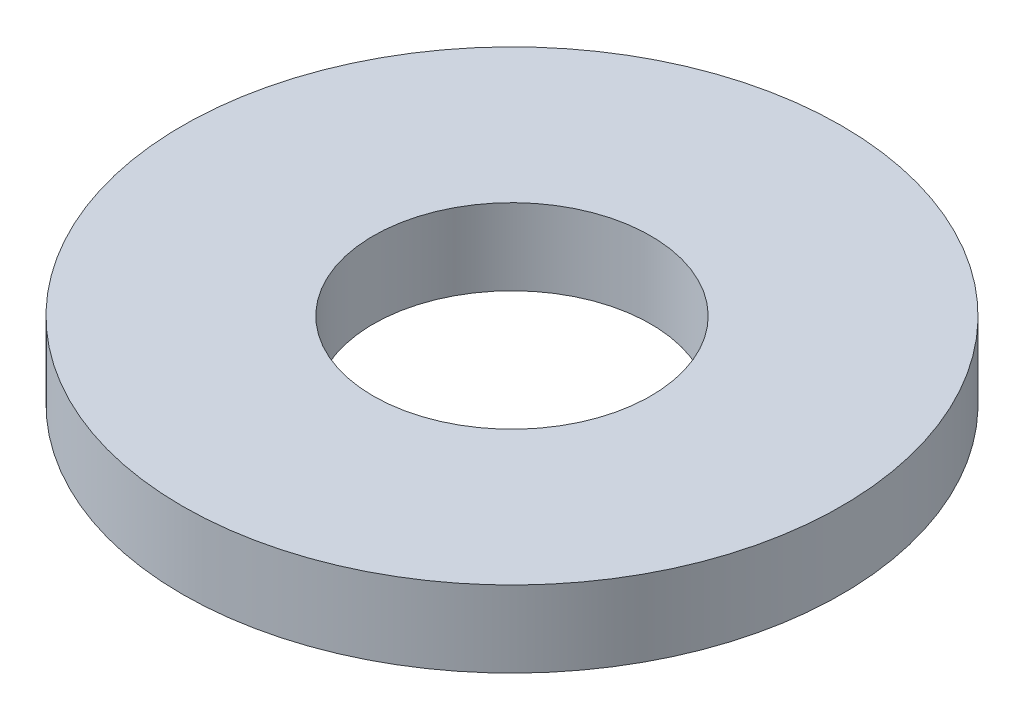
from build123d import *

# Parameters (mm, degrees)
SKETCH1_R           = 95
BOSS_EXTRUDE1_DEPTH = 22
SKETCH2_R           = 40
CUT_EXTRUDE1_DEPTH  = 137.1396342


with BuildPart() as part:
    # Sketch1 → Boss-Extrude1 (new body)
    with BuildSketch(Plane(origin=(0, 0, 0), x_dir=(1, 0, 0), z_dir=(0, 1, 0))):
        Circle(SKETCH1_R)
    extrude(amount=BOSS_EXTRUDE1_DEPTH)

    # Sketch2 → Cut-Extrude1 (cut, through all)
    with BuildSketch(Plane(origin=(0, 0, 0), x_dir=(1, 0, 0), z_dir=(0, 1, 0))):
        Circle(SKETCH2_R)
    extrude(amount=CUT_EXTRUDE1_DEPTH, mode=Mode.SUBTRACT)


solid = part.part
